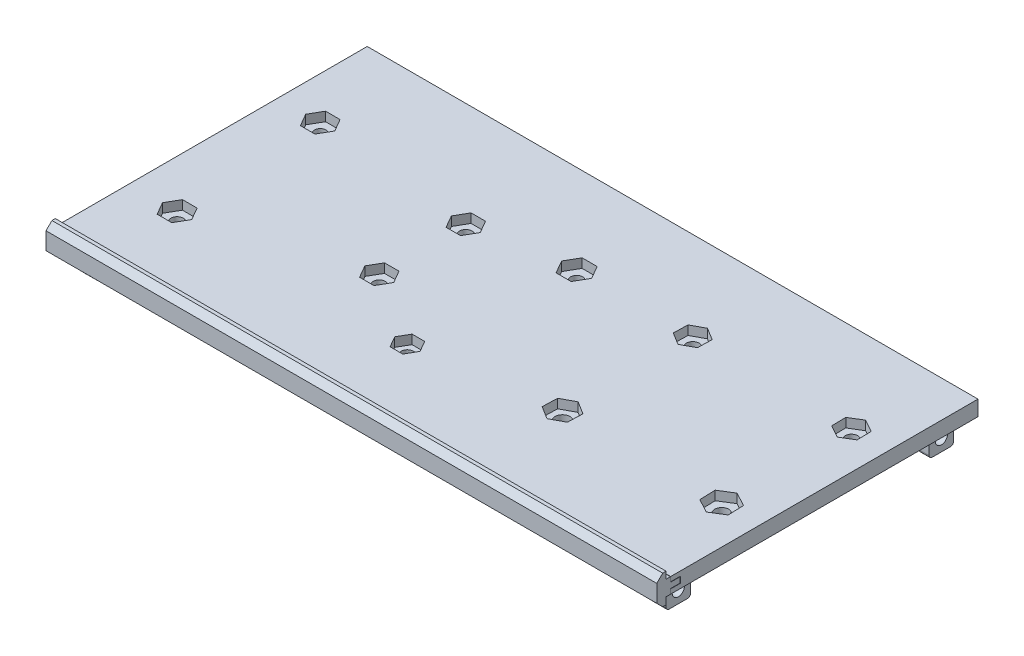
from build123d import *

# Parameters (mm, degrees)
CROQUIS3_W              = 200
CROQUIS3_H              = 100
CROQUIS3_R              = 2.45
CROQUIS3_R_2            = 2.450173308
SALIENTE_EXTRUIR1_DEPTH = 5
SALIENTE_EXTRUIR2_START = -9
CROQUIS4_R              = 3.372577113
CROQUIS4_R_2            = 1.872577113
CROQUIS4_R_3            = 3.527614965
CROQUIS4_R_4            = 2.027614965
CROQUIS4_R_5            = 3.462984948
CROQUIS4_R_6            = 1.962984948
CROQUIS4_R_7            = 3.478351446
CROQUIS4_R_8            = 1.978351446
CROQUIS4_R_9            = 3.459412365
CROQUIS4_R_10           = 1.959412365
CROQUIS4_R_11           = 3.625491316
CROQUIS4_R_12           = 2.125491316
CROQUIS4_R_13           = 4.450173308
CROQUIS4_R_14           = 2.450173308
CROQUIS4_R_15           = 4.124173106
CROQUIS4_R_16           = 2.124173106
CROQUIS4_R_17           = 4.031387243
CROQUIS4_R_18           = 2.031387243
CROQUIS4_R_19           = 4.264908663
CROQUIS4_R_20           = 2.264908663
SALIENTE_EXTRUIR2_DEPTH = 9
SALIENTE_EXTRUIR3_DEPTH = 200
CROQUIS9_W              = 5
CROQUIS9_H              = 8
SALIENTE_EXTRUIR4_DEPTH = 8
REDONDEO1_R             = 1
CROQUIS11_W             = 8
CROQUIS11_H             = 6
SALIENTE_EXTRUIR5_DEPTH = 8
REDONDEO3_R             = 2
CROQUIS13_R             = 2
CORTAR_EXTRUIR3_DEPTH   = 6
CORTAR_EXTRUIR4_START   = -6
CROQUIS14_R             = 2
CORTAR_EXTRUIR4_DEPTH   = 6
CROQUIS15_R             = 2
CORTAR_EXTRUIR5_DEPTH   = 6
CORTAR_EXTRUIR6_DEPTH   = 2.6
MATRIZL1_COUNT          = 2
MATRIZL1_PITCH          = 184.6
CORTAR_EXTRUIR7_DEPTH   = 2.6
MATRIZL2_COUNT          = 2
MATRIZL2_PITCH          = 100
CROQUIS25_R             = 1.872577113
CROQUIS25_R_2           = 2.125491316
CROQUIS25_R_3           = 1.959412365
CROQUIS25_R_4           = 1.978351446
CROQUIS25_R_5           = 1.962984948
CROQUIS25_R_6           = 2.027614965
CORTAR_EXTRUIR8_DEPTH   = 10
CORTAR_EXTRUIR9_START   = 2
CORTAR_EXTRUIR9_DEPTH   = 14
CHAFL_N1_SIZE           = 1
CORTAR_EXTRUIR10_DEPTH  = 210


with BuildPart() as part:
    # Croquis3 → Saliente-Extruir1 (new body)
    with BuildSketch(Plane(origin=(0, 0, 0), x_dir=(1, 0, 0), z_dir=(0, 1, 0))):
        with Locations((-16.001013851, 0)):
            Rectangle(CROQUIS3_W, CROQUIS3_H)
        with Locations((19.48962591, 21.100676249)):
            Circle(CROQUIS3_R, mode=Mode.SUBTRACT)
        with Locations((71.658007858, 20.901971031)):
            Circle(CROQUIS3_R, mode=Mode.SUBTRACT)
        with Locations((71.377578013, -21.310716777)):
            Circle(CROQUIS3_R, mode=Mode.SUBTRACT)
        with Locations((19.142498915, -21.188320431)):
            Circle(CROQUIS3_R_2, mode=Mode.SUBTRACT)
    extrude(amount=SALIENTE_EXTRUIR1_DEPTH)

    # Croquis4 → Saliente-Extruir2 (add)
    # profile 1 of 10: a face of its own
    with BuildSketch(Plane(origin=(0, 5, 0), x_dir=(1, 0, 0), z_dir=(0, 1, 0)).offset(SALIENTE_EXTRUIR2_START)):
        with Locations((-102.096455474, 20.709667607)):
            Circle(CROQUIS4_R)
        with Locations((-102.096455474, 20.709667607)):
            Circle(CROQUIS4_R_2, mode=Mode.SUBTRACT)
    # profile 2 of 10: a face of its own
    with BuildSketch(Plane(origin=(0, 5, 0), x_dir=(1, 0, 0), z_dir=(0, 1, 0)).offset(SALIENTE_EXTRUIR2_START)):
        with Locations((-100.424609792, -27.825911713)):
            Circle(CROQUIS4_R_3)
        with Locations((-100.424609792, -27.825911713)):
            Circle(CROQUIS4_R_4, mode=Mode.SUBTRACT)
    # profile 3 of 10: a face of its own
    with BuildSketch(Plane(origin=(0, 5, 0), x_dir=(1, 0, 0), z_dir=(0, 1, 0)).offset(SALIENTE_EXTRUIR2_START)):
        with Locations((-49.441800463, -12.612645778)):
            Circle(CROQUIS4_R_5)
        with Locations((-49.441800463, -12.612645778)):
            Circle(CROQUIS4_R_6, mode=Mode.SUBTRACT)
    # profile 4 of 10: a face of its own
    with BuildSketch(Plane(origin=(0, 5, 0), x_dir=(1, 0, 0), z_dir=(0, 1, 0)).offset(SALIENTE_EXTRUIR2_START)):
        with Locations((-25.022694884, -27.825911713)):
            Circle(CROQUIS4_R_7)
        with Locations((-25.022694884, -27.825911713)):
            Circle(CROQUIS4_R_8, mode=Mode.SUBTRACT)
    # profile 5 of 10: a face of its own
    with BuildSketch(Plane(origin=(0, 5, 0), x_dir=(1, 0, 0), z_dir=(0, 1, 0)).offset(SALIENTE_EXTRUIR2_START)):
        with Locations((-18.417307326, 20.979986322)):
            Circle(CROQUIS4_R_9)
        with Locations((-18.417307326, 20.979986322)):
            Circle(CROQUIS4_R_10, mode=Mode.SUBTRACT)
    # profile 6 of 10: a face of its own
    with BuildSketch(Plane(origin=(0, 5, 0), x_dir=(1, 0, 0), z_dir=(0, 1, 0)).offset(SALIENTE_EXTRUIR2_START)):
        with Locations((-49.441800463, 15.715109098)):
            Circle(CROQUIS4_R_11)
        with Locations((-49.441800463, 15.715109098)):
            Circle(CROQUIS4_R_12, mode=Mode.SUBTRACT)
    # profile 7 of 10: a face of its own
    with BuildSketch(Plane(origin=(0, 5, 0), x_dir=(1, 0, 0), z_dir=(0, 1, 0)).offset(SALIENTE_EXTRUIR2_START)):
        with Locations((19.142498915, -21.188320431)):
            Circle(CROQUIS4_R_13)
        with Locations((19.142498915, -21.188320431)):
            Circle(CROQUIS4_R_14, mode=Mode.SUBTRACT)
    # profile 8 of 10: a face of its own
    with BuildSketch(Plane(origin=(0, 5, 0), x_dir=(1, 0, 0), z_dir=(0, 1, 0)).offset(SALIENTE_EXTRUIR2_START)):
        with Locations((19.48962591, 21.100676249)):
            Circle(CROQUIS4_R_15)
        with Locations((19.48962591, 21.100676249)):
            Circle(CROQUIS4_R_16, mode=Mode.SUBTRACT)
    # profile 9 of 10: a face of its own
    with BuildSketch(Plane(origin=(0, 5, 0), x_dir=(1, 0, 0), z_dir=(0, 1, 0)).offset(SALIENTE_EXTRUIR2_START)):
        with Locations((71.658007858, 20.901971031)):
            Circle(CROQUIS4_R_17)
        with Locations((71.658007858, 20.901971031)):
            Circle(CROQUIS4_R_18, mode=Mode.SUBTRACT)
    # profile 10 of 10: a face of its own
    with BuildSketch(Plane(origin=(0, 5, 0), x_dir=(1, 0, 0), z_dir=(0, 1, 0)).offset(SALIENTE_EXTRUIR2_START)):
        with Locations((71.377578013, -21.310716777)):
            Circle(CROQUIS4_R_19)
        with Locations((71.377578013, -21.310716777)):
            Circle(CROQUIS4_R_20, mode=Mode.SUBTRACT)
    extrude(amount=SALIENTE_EXTRUIR2_DEPTH)

    # Croquis8 → Saliente-Extruir3 (add)
    with BuildSketch(Plane(origin=(83.998986149, 0, 0), x_dir=(0, 0, -1), z_dir=(1, 0, 0))):
        Polygon((-50, 5), (-52.132961521, 5), (-52.132961521, 7.264269383), (-53.250029395, 7.264269383), (-55.186280375, 5.328018403), (-55.186280375, -0.328018403), (-53.250029395, -2.264269383), (-52.132961521, -2.264269383), (-52.132961521, 0), (-50, 0), align=None)
    extrude(amount=-SALIENTE_EXTRUIR3_DEPTH)

    # Croquis9 → Saliente-Extruir4 (add)
    with BuildSketch(Plane.XZ):
        with Locations((-109.501013851, 44.132961521)):
            Rectangle(CROQUIS9_W, CROQUIS9_H)
        with Locations((77.498986149, 44.132961521)):
            Rectangle(CROQUIS9_W, CROQUIS9_H)
        with Locations((77.498986149, -42)):
            Rectangle(CROQUIS9_W, CROQUIS9_H)
        with Locations((-109.501013851, -42)):
            Rectangle(CROQUIS9_W, CROQUIS9_H)
    extrude(amount=SALIENTE_EXTRUIR4_DEPTH)

    # Redondeo1
    redondeo1_edges = [part.edges().sort_by_distance(p)[0] for p in [
        (-109.501013851, -8, 40.132961521),
        (-109.501013851, -8, 48.132961521),
        (-109.501013851, -8, -38),
        (-109.501013851, -8, -46),
        (77.498986149, -8, -38),
        (77.498986149, -8, -46),
        (77.498986149, -8, 40.132961521),
        (77.498986149, -8, 48.132961521),
    ]]
    fillet(redondeo1_edges, radius=REDONDEO1_R)

    # Croquis11 → Saliente-Extruir5 (add)
    with BuildSketch(Plane.XZ):
        with Locations((-53.435930005, -43)):
            Rectangle(CROQUIS11_W, CROQUIS11_H)
        with Locations((46.564069995, -43)):
            Rectangle(CROQUIS11_W, CROQUIS11_H)
    extrude(amount=SALIENTE_EXTRUIR5_DEPTH)

    # Redondeo3
    redondeo3_edges = [part.edges().sort_by_distance(p)[0] for p in [
        (-57.435930005, -8, -43),
        (-49.435930005, -8, -43),
        (42.564069995, -8, -43),
        (50.564069995, -8, -43),
    ]]
    fillet(redondeo3_edges, radius=REDONDEO3_R)

    # Croquis13 → Cortar-Extruir3 (cut)
    with BuildSketch(Plane.ZY.offset(112.001013851)):
        with Locations((-42, -4)):
            Circle(CROQUIS13_R)
        with Locations((44.132961521, -4)):
            Circle(CROQUIS13_R)
    extrude(amount=-CORTAR_EXTRUIR3_DEPTH, mode=Mode.SUBTRACT)

    # Croquis14 → Cortar-Extruir4 (cut)
    with BuildSketch(Plane(origin=(79.998986149, 0, 0), x_dir=(0, 0, -1), z_dir=(1, 0, 0)).offset(CORTAR_EXTRUIR4_START)):
        with Locations((-44.132961521, -4)):
            Circle(CROQUIS14_R)
        with Locations((42, -4)):
            Circle(CROQUIS14_R)
    extrude(amount=CORTAR_EXTRUIR4_DEPTH, mode=Mode.SUBTRACT)

    # Croquis15 → Cortar-Extruir5 (cut)
    with BuildSketch(Plane(origin=(0, 0, -46), x_dir=(-1, 0, 0), z_dir=(0, 0, -1))):
        with Locations((-46.564069995, -4)):
            Circle(CROQUIS15_R)
        with Locations((53.435930005, -4)):
            Circle(CROQUIS15_R)
    extrude(amount=-CORTAR_EXTRUIR5_DEPTH, mode=Mode.SUBTRACT)

    # Croquis16 → Cortar-Extruir6 (cut)
    with BuildSketch(Plane(origin=(-107.001013851, 0, 0), x_dir=(0, 0, -1), z_dir=(1, 0, 0))):
        Polygon((39.158006208, -5.589424829), (41.955485383, -7.255951236), (44.797479175, -5.666526407), (44.841993792, -2.410575171), (42.044514617, -0.744048764), (39.202520825, -2.333473593), align=None)
        Polygon((-46.865222278, -5.771426305), (-43.964991718, -7.251920378), (-41.232730961, -5.480494073), (-41.400700764, -2.228573695), (-44.300931324, -0.748079622), (-47.033192081, -2.519505927), align=None)
    cortar_extruir6 = extrude(amount=-CORTAR_EXTRUIR6_DEPTH, mode=Mode.SUBTRACT)

    # MatrizL1: Cortar-Extruir6 ×2
    with Locations(*[(i * MATRIZL1_PITCH, 0, 0) for i in range(1, MATRIZL1_COUNT)]):
        add(cortar_extruir6, mode=Mode.SUBTRACT)

    # Croquis17 → Cortar-Extruir7 (cut)
    with BuildSketch(Plane.XY.offset(-40)):
        Polygon((49.376038588, -2.358040004), (46.548075223, -0.743783765), (43.736106629, -2.385743761), (43.752101401, -5.641959996), (46.580064767, -7.256216235), (49.39203336, -5.614256239), align=None)
    cortar_extruir7 = extrude(amount=-CORTAR_EXTRUIR7_DEPTH, mode=Mode.SUBTRACT)

    # MatrizL2: Cortar-Extruir7 ×2
    with Locations(*[(-i * MATRIZL2_PITCH, 0, 0) for i in range(1, MATRIZL2_COUNT)]):
        add(cortar_extruir7, mode=Mode.SUBTRACT)

    # Croquis25 → Cortar-Extruir8 (cut)
    with BuildSketch(Plane(origin=(0, 0, 0), x_dir=(1, 0, 0), z_dir=(0, 1, 0))):
        with Locations((-102.096455474, 20.709667607)):
            Circle(CROQUIS25_R)
        with Locations((-49.441800463, 15.715109098)):
            Circle(CROQUIS25_R_2)
        with Locations((-18.417307326, 20.979986322)):
            Circle(CROQUIS25_R_3)
        with Locations((-25.022694884, -27.825911713)):
            Circle(CROQUIS25_R_4)
        with Locations((-49.441800463, -12.612645778)):
            Circle(CROQUIS25_R_5)
        with Locations((-100.424609792, -27.825911713)):
            Circle(CROQUIS25_R_6)
    extrude(amount=CORTAR_EXTRUIR8_DEPTH, mode=Mode.SUBTRACT)

    # Croquis26 → Cortar-Extruir9 (cut)
    with BuildSketch(Plane(origin=(0, 0, 0), x_dir=(1, 0, 0), z_dir=(0, 1, 0)).offset(CORTAR_EXTRUIR9_START)):
        Polygon((-13.501013851, 20.979986322), (-15.959160588, 25.237621363), (-20.875454063, 25.237621363), (-23.3336008, 20.979986322), (-20.875454063, 16.722351281), (-15.959160588, 16.722351281), align=None)
        Polygon((-20.875454063, -27.825911713), (-22.949074474, -24.234295806), (-27.096315295, -24.234295806), (-29.169935705, -27.825911713), (-27.096315295, -31.417527619), (-22.949074474, -31.417527619), align=None)
        Polygon((-44.720541343, -12.612645778), (-47.081170903, -8.523915442), (-51.802430023, -8.523915442), (-54.163059583, -12.612645778), (-51.802430023, -16.701376113), (-47.081170903, -16.701376113), align=None)
        Polygon((-44.720541343, 15.715109098), (-47.081170903, 19.803839433), (-51.802430023, 19.803839433), (-54.163059583, 15.715109098), (-51.802430023, 11.626378762), (-47.081170903, 11.626378762), align=None)
        Polygon((-97.342399162, 20.709667607), (-99.719427318, 24.826801144), (-104.47348363, 24.826801144), (-106.850511786, 20.709667607), (-104.47348363, 16.59253407), (-99.719427318, 16.59253407), align=None)
        Polygon((-95.638047492, -27.825911713), (-98.031328642, -23.680627164), (-102.817890942, -23.680627164), (-105.211172092, -27.825911713), (-102.817890942, -31.971196261), (-98.031328642, -31.971196261), align=None)
        Polygon((23.613799016, 23.3462389), (19.606998162, 25.795096254), (15.482825056, 23.549533604), (15.365452804, 18.855113599), (19.372253658, 16.406256245), (23.496426764, 18.651818895), align=None)
        Polygon((75.689395101, 23.3462389), (71.556903412, 25.615388731), (67.525516169, 23.171120862), (67.626620615, 18.457703163), (71.759112304, 16.188553332), (75.790499547, 18.632821201), align=None)
        Polygon((75.790499547, -18.566006086), (71.207049596, -16.116659278), (66.794128062, -18.861369968), (66.964656479, -24.055427467), (71.54810643, -26.504774275), (75.961027964, -23.760063585), align=None)
        Polygon((23.496426764, -18.861369968), (19.304264625, -16.254233076), (14.950336776, -18.581183539), (14.788571066, -23.515270894), (18.980733205, -26.122407786), (23.334661054, -23.795457323), align=None)
    extrude(amount=CORTAR_EXTRUIR9_DEPTH, mode=Mode.SUBTRACT)

    # Chaflán1
    chafl_n1_edges = [part.edges().sort_by_distance(p)[0] for p in [
        (67.112669349, -4, 21.310716777),
        (67.626620615, -4, -20.901971031),
        (15.365452804, -4, -21.100676249),
        (14.692325607, -4, 21.188320431),
        (-28.50104633, -4, 27.825911713),
        (-21.876719691, -4, -20.979986322),
        (-53.067291779, -4, -15.715109098),
        (-52.90478541, -4, 12.612645778),
        (-103.952224757, -4, 27.825911713),
        (-105.469032587, -4, -20.709667607),
    ]]
    chamfer(chafl_n1_edges, length=CHAFL_N1_SIZE)

    # Croquis27 → Cortar-Extruir10 (cut)
    with BuildSketch(Plane.ZY.offset(116.001013851)):
        Polygon((50.74217544, 5), (50.64217544, 5), (50.64217544, 3.5), (47.457602002, 3.5), (47.457602002, 1.5), (50.64217544, 1.5), (50.64217544, 0), (50.74217544, 0), (50.74217544, 1.6), (47.557602002, 1.6), (47.557602002, 3.4), (50.74217544, 3.4), align=None)
    extrude(amount=-CORTAR_EXTRUIR10_DEPTH, mode=Mode.SUBTRACT)


with BuildPart() as cortar_extruir10_piece_1:
    # of the separate pieces the step leaves, piece 1, a body of its own (cortar_extruir10_pieces)
    add(part.part.solids().sort_by_distance((75.642486676, -3, 21.310716777))[0])


with BuildPart() as cortar_extruir10_piece_2:
    # of the separate pieces the step leaves, piece 2, a body of its own (cortar_extruir10_pieces)
    add(part.part.solids().sort_by_distance((-116.001013851, 0, 50.74217544))[0])


solid = Compound([cortar_extruir10_piece_1.part, cortar_extruir10_piece_2.part])
